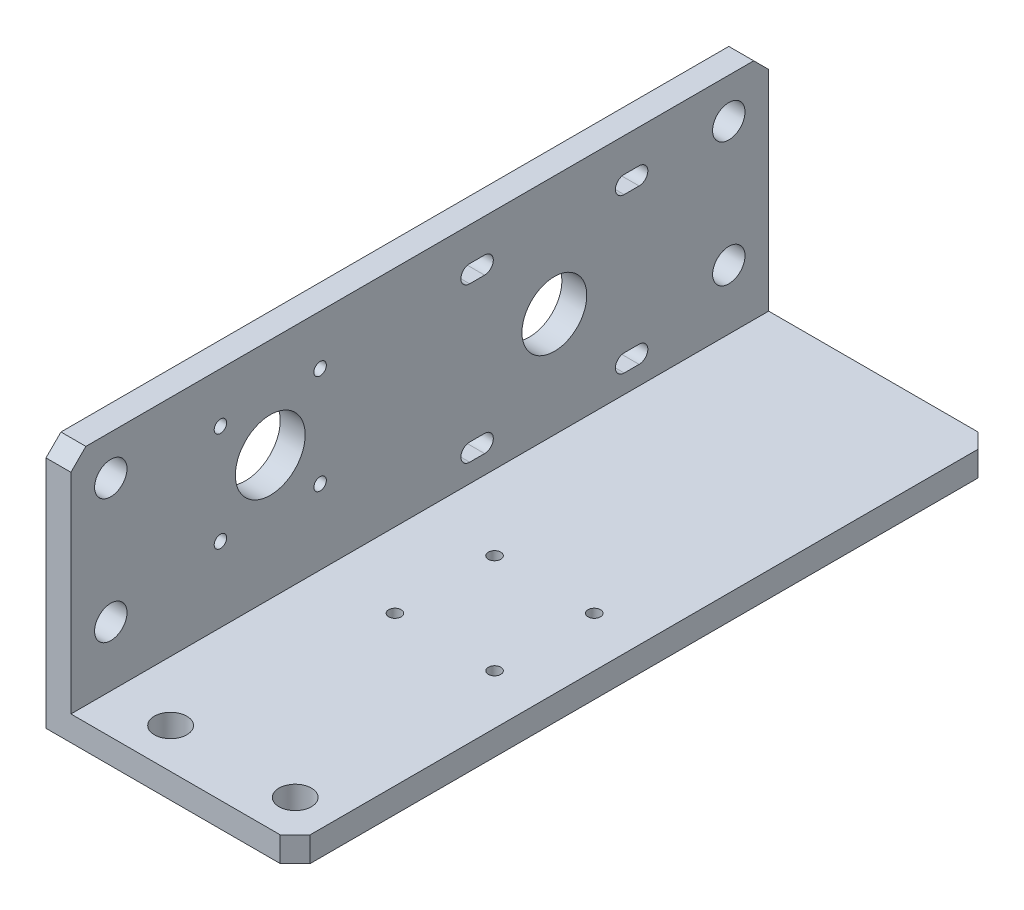
from build123d import *

# Parameters (mm, degrees)
ESTRUSIONE_ESTRUSIONE1_DEPTH = 140
FORO_6_5_6_5_1_D             = 6.5
FORO_6_5_6_5_2_AT_2_COUNT    = 2
FORO_6_5_6_5_2_AT_2_PITCH    = 25
TAGLIO_ESTRUSIONE2_REACH     = 158.844
SCHIZZO9_R                   = 7
TAGLIO_ESTRUSIONE4_REACH     = 158.844
SCHIZZO11_R                  = 6.5
SMUSSO1_SIZE                 = 3
M3_TAPPED_HOLE1_D            = 2.5
M3_TAPPED_HOLE2_D            = 2.5


with BuildPart() as part:
    # Schizzo1 → Estrusione-Estrusione1 (new body)
    with BuildSketch(Plane.XY):
        Polygon((0, 0), (0, 50), (5, 50), (5, 5), (50, 5), (50, 0), align=None)
    extrude(amount=ESTRUSIONE_ESTRUSIONE1_DEPTH)

    # Foro Ø6.5 (6.5)-1 (through all)
    with Locations(Plane(origin=(0, 0, 0), x_dir=(-1, 0, 0), z_dir=(0, -1, 0))):
        with Locations((-17, -132), (-42, -132)):
            Hole(FORO_6_5_6_5_1_D / 2)

    # Schizzo6 → Foro Ø6.5 (6.5)-2 (revolve, cut)
    with BuildSketch(Plane(origin=(0, 42, 132), x_dir=(0, 0, 1), z_dir=(0, 1, 0))):
        Polygon((0, 0), (0, 6.952797012), (3.25, 5), (3.25, 0), align=None)
    foro_6_5_6_5_2 = revolve(axis=Axis((-6.35, 42, 132), (1, 0, 0)), mode=Mode.SUBTRACT)

    # Foro Ø6.5 (6.5)-2 at 2: Foro Ø6.5 (6.5)-2 ×2
    with Locations(*[(0, -i * FORO_6_5_6_5_2_AT_2_PITCH, 0) for i in range(1, FORO_6_5_6_5_2_AT_2_COUNT)]):
        add(foro_6_5_6_5_2, mode=Mode.SUBTRACT)

    # Specchia1: Foro Ø6.5 (6.5)-2 across plane
    add(foro_6_5_6_5_2.mirror(Plane.XY.offset(70)), mode=Mode.SUBTRACT)

    # Specchia1 copy 1 sketch → Specchia1 copy 1 (revolve, cut)
    with BuildSketch(Plane(origin=(0, 17, 8), x_dir=(0, 0, -1), z_dir=(0, 1, 0))):
        Polygon((0, 0), (0, -6.952797012), (3.25, -5), (3.25, 0), align=None)
    revolve(axis=Axis((-6.35, 17, 8), (-1, 0, 0)), mode=Mode.SUBTRACT)

    # Schizzo9 → Taglio-Estrusione2 (cut, up to next)
    with BuildSketch(Plane.ZY, mode=Mode.PRIVATE) as taglio_estrusione2_sk1:
        with Locations((100, 30)):
            Circle(SCHIZZO9_R)
    taglio_estrusione2_tool1 = extrude(taglio_estrusione2_sk1.sketch, amount=-TAGLIO_ESTRUSIONE2_REACH, mode=Mode.PRIVATE) & part.part
    add(taglio_estrusione2_tool1.solids().sort_by_distance((0, 30, 100))[0], mode=Mode.SUBTRACT)

    # Schizzo11 → Taglio-Estrusione4 (cut, up to next)
    with BuildSketch(Plane.ZY, mode=Mode.PRIVATE) as taglio_estrusione4_sk1:
        with Locations((43, 26)):
            Circle(SCHIZZO11_R)
    taglio_estrusione4_tool1 = extrude(taglio_estrusione4_sk1.sketch, amount=-TAGLIO_ESTRUSIONE4_REACH, mode=Mode.PRIVATE) & part.part
    # Schizzo11 → Taglio-Estrusione4 (cut, up to next)
    with BuildSketch(Plane.ZY, mode=Mode.PRIVATE) as taglio_estrusione4_sk2:
        with BuildLine():
            Line((60, 39.75), (57, 39.75))
            ThreePointArc((57, 39.75), (55.25, 41.5), (57, 43.25))
            Line((57, 43.25), (60, 43.25))
            ThreePointArc((60, 43.25), (61.75, 41.5), (60, 39.75))
        make_face()
    taglio_estrusione4_tool2 = extrude(taglio_estrusione4_sk2.sketch, amount=-TAGLIO_ESTRUSIONE4_REACH, mode=Mode.PRIVATE) & part.part
    # Schizzo11 → Taglio-Estrusione4 (cut, up to next)
    with BuildSketch(Plane.ZY, mode=Mode.PRIVATE) as taglio_estrusione4_sk3:
        with BuildLine():
            Line((60, 12.25), (57, 12.25))
            ThreePointArc((57, 12.25), (55.25, 10.5), (57, 8.75))
            Line((57, 8.75), (60, 8.75))
            ThreePointArc((60, 8.75), (61.75, 10.5), (60, 12.25))
        make_face()
    taglio_estrusione4_tool3 = extrude(taglio_estrusione4_sk3.sketch, amount=-TAGLIO_ESTRUSIONE4_REACH, mode=Mode.PRIVATE) & part.part
    # Schizzo11 → Taglio-Estrusione4 (cut, up to next)
    with BuildSketch(Plane.ZY, mode=Mode.PRIVATE) as taglio_estrusione4_sk4:
        with BuildLine():
            Line((26, 12.25), (29, 12.25))
            ThreePointArc((29, 12.25), (30.75, 10.5), (29, 8.75))
            Line((29, 8.75), (26, 8.75))
            ThreePointArc((26, 8.75), (24.25, 10.5), (26, 12.25))
        make_face()
    taglio_estrusione4_tool4 = extrude(taglio_estrusione4_sk4.sketch, amount=-TAGLIO_ESTRUSIONE4_REACH, mode=Mode.PRIVATE) & part.part
    # Schizzo11 → Taglio-Estrusione4 (cut, up to next)
    with BuildSketch(Plane.ZY, mode=Mode.PRIVATE) as taglio_estrusione4_sk5:
        with BuildLine():
            Line((26, 39.75), (29, 39.75))
            ThreePointArc((29, 39.75), (30.75, 41.5), (29, 43.25))
            Line((29, 43.25), (26, 43.25))
            ThreePointArc((26, 43.25), (24.25, 41.5), (26, 39.75))
        make_face()
    taglio_estrusione4_tool5 = extrude(taglio_estrusione4_sk5.sketch, amount=-TAGLIO_ESTRUSIONE4_REACH, mode=Mode.PRIVATE) & part.part
    add(taglio_estrusione4_tool1.solids().sort_by_distance((0, 26, 43))[0], mode=Mode.SUBTRACT)
    add(taglio_estrusione4_tool2.solids().sort_by_distance((0, 41.5, 58.5))[0], mode=Mode.SUBTRACT)
    add(taglio_estrusione4_tool3.solids().sort_by_distance((0, 10.5, 58.5))[0], mode=Mode.SUBTRACT)
    add(taglio_estrusione4_tool4.solids().sort_by_distance((0, 10.5, 27.5))[0], mode=Mode.SUBTRACT)
    add(taglio_estrusione4_tool5.solids().sort_by_distance((0, 41.5, 27.5))[0], mode=Mode.SUBTRACT)

    # Smusso1
    smusso1_edges = [part.edges().sort_by_distance(p)[0] for p in [
        (50, 2.5, 0),
        (2.5, 50, 0),
        (2.5, 50, 140),
        (50, 2.5, 140),
    ]]
    chamfer(smusso1_edges, length=SMUSSO1_SIZE)

    # M3 Tapped Hole1 (through all)
    with Locations(Plane(origin=(0, 40, 90), x_dir=(0, 0, -1), z_dir=(-1, 0, 0))):
        with Locations((0, 0), (-20, 0), (-20, 20), (0, 20)):
            Hole(M3_TAPPED_HOLE1_D / 2)

    # M3 Tapped Hole2 (through all)
    with Locations(Plane(origin=(20, 0, 90), x_dir=(-1, 0, 0), z_dir=(0, -1, 0))):
        with Locations((0, 0), (-20, 0), (-20, 20), (0, 20)):
            Hole(M3_TAPPED_HOLE2_D / 2)


solid = part.part
